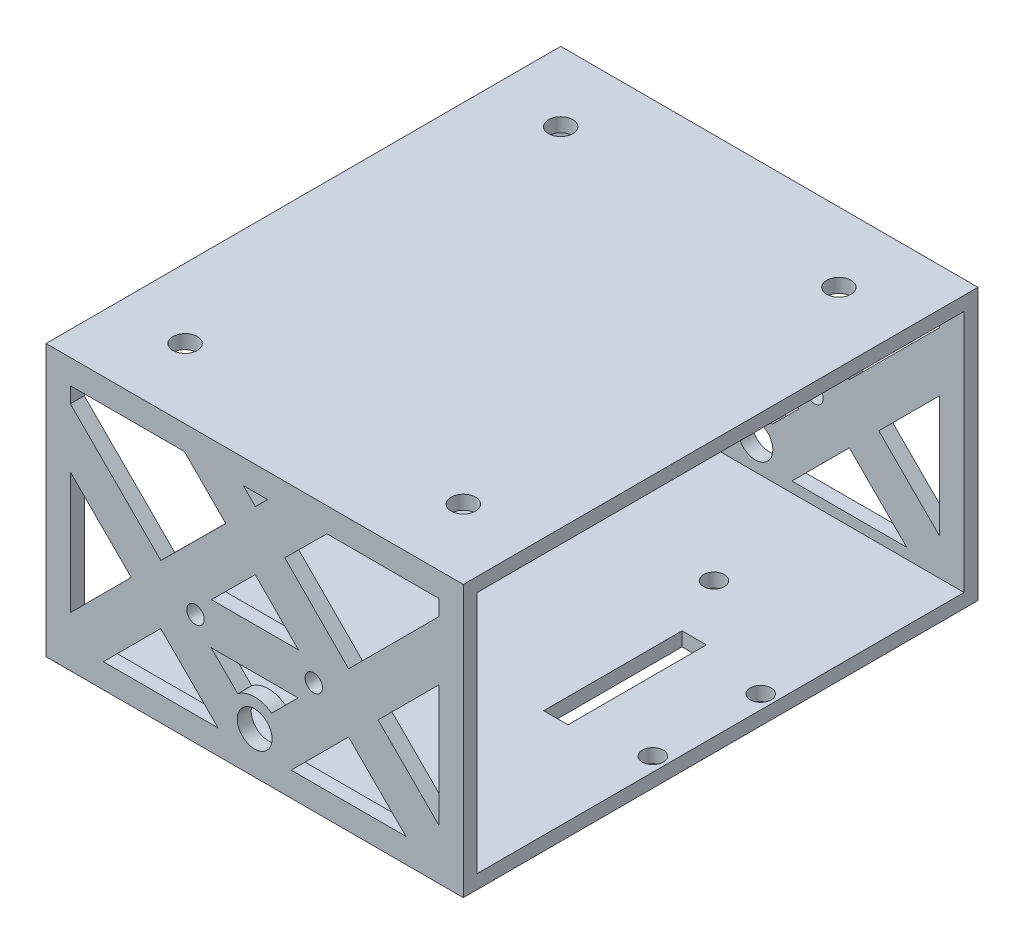
from build123d import *

# Parameters (mm, degrees)
BOSS_EXTRUDE1_DEPTH      = 30
BOSS_EXTRUDE1_DEPTH_BACK = 30
SKETCH2_W                = 74
SKETCH2_H                = 39
SKETCH2_W_2              = 70
SKETCH2_H_2              = 35
CUT_EXTRUDE1_DEPTH       = 65.171644829
CUT_EXTRUDE1_DEPTH_BACK  = 65.171644829
SKETCH1_R                = 1.25
SKETCH1_R_2              = 2.5
CUT_EXTRUDE2_START       = -37
CUT_EXTRUDE2_DEPTH       = 74
SKETCH4_R                = 1.75
CUT_EXTRUDE3_DEPTH       = 3
SKETCH5_R                = 1.5
SKETCH5_W                = 3.5
SKETCH5_H                = 19.9
CUT_EXTRUDE4_DEPTH       = 61.3158354


# Read off the part's stored shape, not the designer's step: Cut-Extrude2
with BuildPart() as part:
    # Sketch2 → Boss-Extrude1 (new, two sides: drawn at the far end of the back side and taken through both)
    with BuildSketch(Plane(origin=(0, 0, 0), x_dir=(0, 0, -1), z_dir=(1, 0, 0)).offset(-BOSS_EXTRUDE1_DEPTH_BACK)):
        with Locations((0, 23.5)):
            Rectangle(SKETCH2_W, SKETCH2_H)
        with Locations((0, 23.5)):
            Rectangle(SKETCH2_W_2, SKETCH2_H_2, mode=Mode.SUBTRACT)
    extrude(amount=BOSS_EXTRUDE1_DEPTH + BOSS_EXTRUDE1_DEPTH_BACK)

    # Sketch1 → Cut-Extrude1 (cut, two sides: drawn at the far end of the back side and taken through both)
    with BuildSketch(Plane.XY.offset(-CUT_EXTRUDE1_DEPTH_BACK)):
        with Locations((8.5, 20)):
            Circle(SKETCH1_R)
        with Locations((-8.5, 20)):
            Circle(SKETCH1_R)
        with Locations((0, 10)):
            Circle(SKETCH1_R_2)
    extrude(amount=CUT_EXTRUDE1_DEPTH + CUT_EXTRUDE1_DEPTH_BACK, mode=Mode.SUBTRACT)

    # Cut-Extrude2 outline → Cut-Extrude2 (cut)
    with BuildSketch(Plane.XY.offset(CUT_EXTRUDE2_START)):
        Polygon((-6.223385238, 23), (6.291063493, 23), (0.075182746, 29.257087778), align=None)
        Polygon((-13.493003356, 24.235644043), (-4.153418424, 33.513721677), (-10.100273174, 39.5), (-26.5, 39.5), (-26.5, 37.242640687), align=None)
        Polygon((10.385998459, 39.5), (4.331816644, 33.485688948), (13.507019797, 24.249660484), (26.5, 37.242640687), (26.5, 39.5), align=None)
        Polygon((21.757359313, 7.5), (13.5, 15.757359313), (5.242640687, 7.5), align=None)
        Polygon((26.5, 28.757359313), (17.742640687, 20), (26.5, 11.242640687), align=None)
        Polygon((-13.5, 15.757359313), (-21.757359313, 7.5), (-5.242640687, 7.5), align=None)
        with BuildLine():
            Line((2.432627089, 13.175267776), (6.257359313, 17))
            Line((6.257359313, 17), (-6.257359313, 17))
            Line((-6.257359313, 17), (-2.432627089, 13.175267776))
            ThreePointArc((-2.432627089, 13.175267776), (0, 14), (2.432627089, 13.175267776))
        make_face()
        Polygon((-26.5, 11.242640687), (-17.742640687, 20), (-26.5, 28.757359313), align=None)
        Polygon((1.872544824, 39.5), (-1.642886221, 39.5), (0.103215475, 37.742322846), align=None)
    extrude(amount=CUT_EXTRUDE2_DEPTH, mode=Mode.SUBTRACT)

    # Sketch4 → Cut-Extrude3 (cut)
    with BuildSketch(Plane(origin=(0, 43, 0), x_dir=(1, 0, 0), z_dir=(0, 1, 0))):
        with Locations(Location((-20, 27, 0), (0, 0, 270))):
            Circle(SKETCH4_R)
        with Locations(Location((20, 27, 0), (0, 0, 270))):
            Circle(SKETCH4_R)
        with Locations(Location((20, -27, 0), (0, 0, 270))):
            Circle(SKETCH4_R)
        with Locations(Location((-20, -27, 0), (0, 0, 270))):
            Circle(SKETCH4_R)
    extrude(amount=-CUT_EXTRUDE3_DEPTH, mode=Mode.SUBTRACT)

    # Sketch5 → Cut-Extrude4 (cut, through all)
    with BuildSketch(Plane(origin=(0, 6, 0), x_dir=(1, 0, 0), z_dir=(0, 1, 0))):
        with Locations(Location((-26.460092097, -18.5, 0), (0, 0, 270))):
            Circle(SKETCH5_R)
        with Locations(Location((-26.460092097, 18.5, 0), (0, 0, 270))):
            Circle(SKETCH5_R)
        with Locations(Location((10.539907903, 18.5, 0), (0, 0, 270))):
            Circle(SKETCH5_R)
        with Locations(Location((10.539907903, -18.5, 0), (0, 0, 270))):
            Circle(SKETCH5_R)
        with Locations(Location((28, -7.75, 0), (0, 0, 270))):
            Circle(SKETCH5_R)
        with Locations(Location((28, 7.75, 0), (0, 0, 270))):
            Circle(SKETCH5_R)
        with Locations((16.25, 0)):
            Rectangle(SKETCH5_W, SKETCH5_H)
    extrude(amount=-CUT_EXTRUDE4_DEPTH, mode=Mode.SUBTRACT)


solid = part.part
